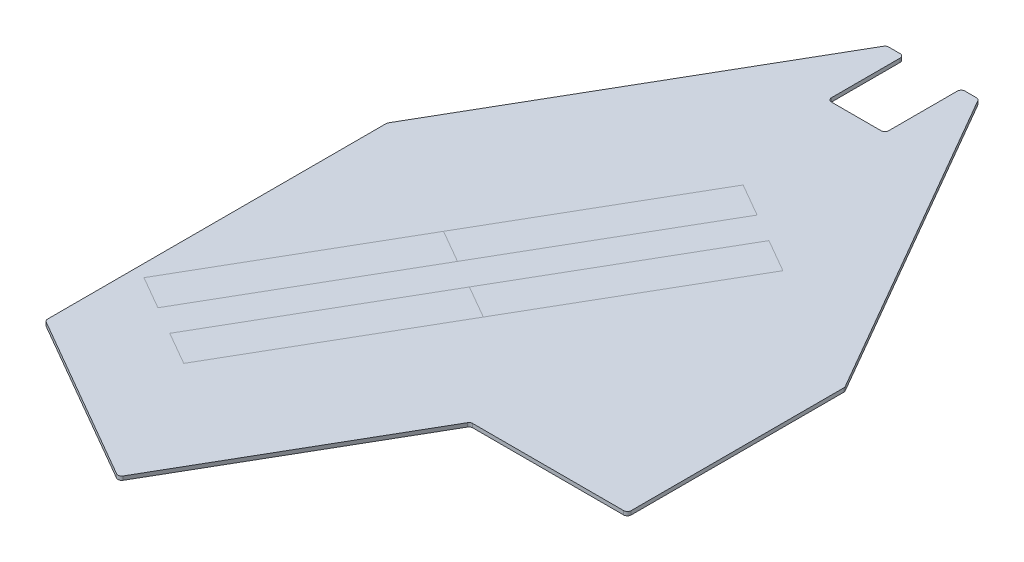
from build123d import *

# Parameters (mm, degrees)
BOSS_EXTRUDE2_DEPTH = 10


with BuildPart() as part:
    # Sketch1 → Boss-Extrude2 (new body)
    with BuildSketch(Plane(origin=(0, 0, 0), x_dir=(1, 0, 0), z_dir=(0, 1, 0))):
        with BuildLine():
            Line((590, 0), (194.448637287, 0))
            ThreePointArc((194.448637287, 0), (189.448637287, -1.339745962), (185.788383249, -5))
            Line((185.788383249, -5), (-144.675037911, -577.379435493))
            ThreePointArc((-144.675037911, -577.379435493), (-150.747101498, -582.038693755), (-158.335291949, -581.03968953))
            Line((-158.335291949, -581.03968953), (-595, -328.931202792))
            ThreePointArc((-595, -328.931202792), (-598.660254038, -325.270948754), (-600, -320.270948754))
            Line((-600, -320.270948754), (-600, 0))
            Line((-600, 0), (-600, 567.320508076))
            ThreePointArc((-600, 567.320508076), (-599.659258263, 569.908698527), (-598.660254038, 572.320508076))
            Line((-598.660254038, 572.320508076), (-123.686027919, 1395))
            ThreePointArc((-123.686027919, 1395), (-120.025773881, 1398.660254038), (-115.025773881, 1400))
            Line((-115.025773881, 1400), (-85, 1400))
            ThreePointArc((-85, 1400), (-77.928932188, 1397.071067812), (-75, 1390))
            Line((-75, 1390), (-75, 1210))
            ThreePointArc((-75, 1210), (-72.071067812, 1202.928932188), (-65, 1200))
            Line((-65, 1200), (65, 1200))
            ThreePointArc((65, 1200), (72.071067812, 1202.928932188), (75, 1210))
            Line((75, 1210), (75, 1390))
            ThreePointArc((75, 1390), (77.928932188, 1397.071067812), (85, 1400))
            Line((85, 1400), (115.025773881, 1400))
            ThreePointArc((115.025773881, 1400), (120.025773881, 1398.660254038), (123.686027919, 1395))
            Line((123.686027919, 1395), (598.660254038, 572.320508076))
            ThreePointArc((598.660254038, 572.320508076), (599.659258263, 569.908698527), (600, 567.320508076))
            Line((600, 567.320508076), (600, 10))
            ThreePointArc((600, 10), (597.071067812, 2.928932188), (590, 0))
        make_face()
    extrude(amount=BOSS_EXTRUDE2_DEPTH)


solid = part.part
